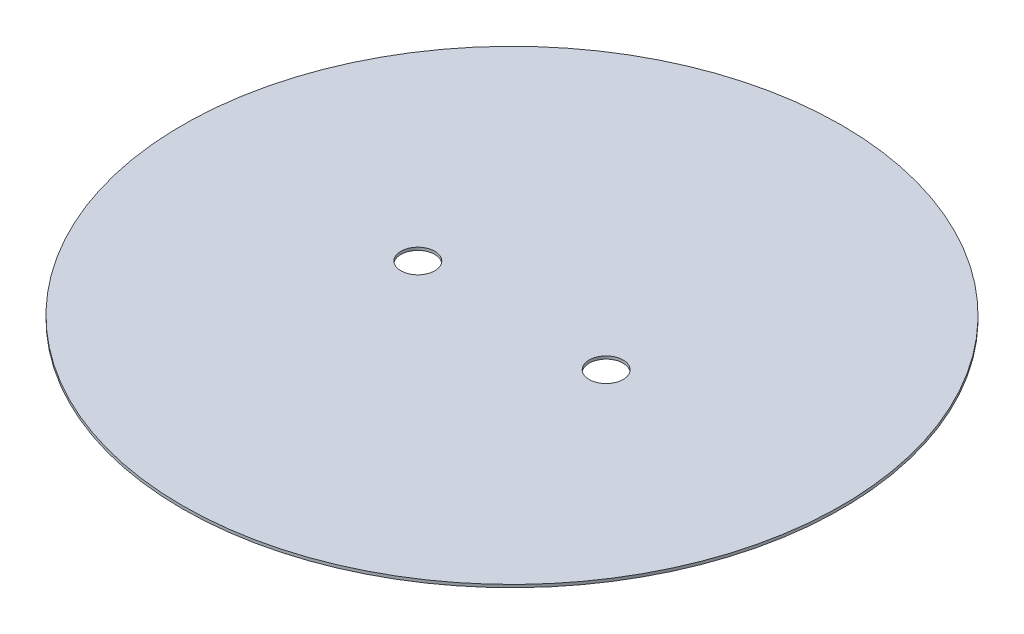
from build123d import *

# Parameters (mm, degrees)
SKETCH1_R           = 1750
BOSS_EXTRUDE1_DEPTH = 15
SKETCH2_R           = 90
CUT_EXTRUDE1_DEPTH  = 50


with BuildPart() as part:
    # Sketch1 → Boss-Extrude1 (new body)
    with BuildSketch(Plane(origin=(0, 0, 0), x_dir=(1, 0, 0), z_dir=(0, 1, 0))):
        Circle(SKETCH1_R)
    extrude(amount=BOSS_EXTRUDE1_DEPTH)

    # Sketch2 → Cut-Extrude1 (cut)
    with BuildSketch(Plane(origin=(0, 15, 0), x_dir=(1, 0, 0), z_dir=(0, 1, 0))):
        with Locations((-500, 0)):
            Circle(SKETCH2_R)
        with Locations((500, 0)):
            Circle(SKETCH2_R)
    extrude(amount=-CUT_EXTRUDE1_DEPTH, mode=Mode.SUBTRACT)


solid = part.part
